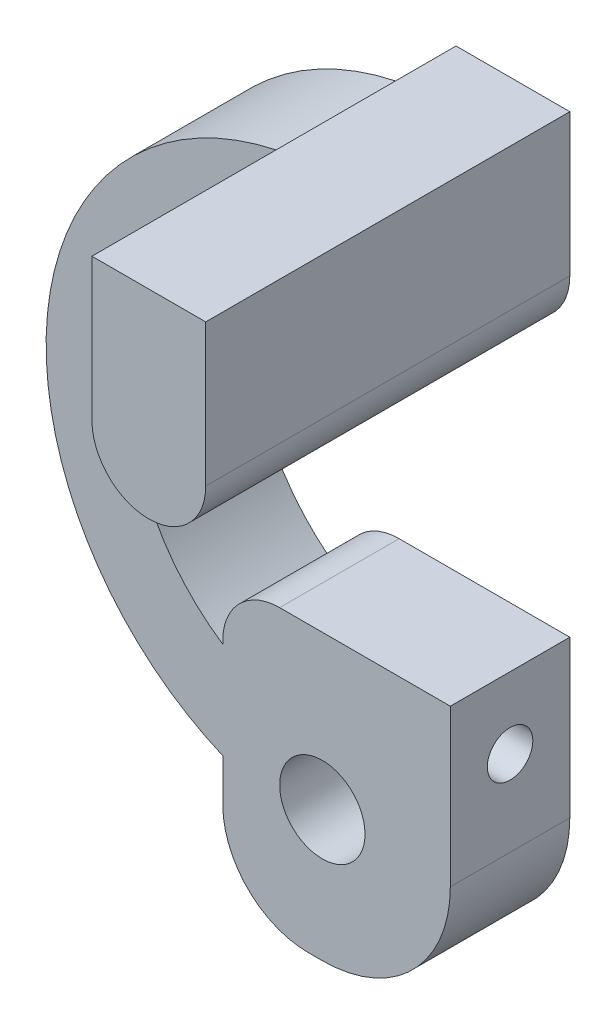
from build123d import *

# Parameters (mm, degrees)
BOSS_EXTRUDE1_DEPTH             = 4.2
SKETCH2_W                       = 4
SKETCH2_H                       = 7
BOSS_EXTRUDE2_DEPTH             = 8.6
FILLET1_R                       = 4.5
HOLE1_D                         = 3
HOLE1_DEPTH                     = 100
FILLET3_R                       = 2
FILLET4_R                       = 2
FILLET5_R                       = 3
TAP_DRILL_FOR_M2X0_4_TAP1_D     = 1.6
TAP_DRILL_FOR_M2X0_4_TAP1_DEPTH = 1.98
TAP_DRILL_FOR_M2X0_4_TAP1_TIP   = 0.480688495


with BuildPart() as part:
    # Sketch1 → Boss-Extrude1 (new body)
    with BuildSketch(Plane.XY):
        with BuildLine():
            Line((4, 26), (4, 24.096998671))
            ThreePointArc((4, 24.096998671), (6.041195573, 23.890909602), (8, 23.280961007))
            Line((8, 23.280961007), (8, 26))
            Line((8, 26), (4, 26))
        make_face()
        with BuildLine():
            ThreePointArc((8, 23.280961007), (6.041195573, 23.890909602), (4, 24.096998671))
            Line((4, 24.096998671), (4, 21.096998671))
            ThreePointArc((4, 21.096998671), (6.089651945, 20.787605561), (8, 19.885973898))
            Line((8, 19.885973898), (8, 23.280961007))
        make_face()
        with BuildLine():
            ThreePointArc((8, 19.885973898), (6.089651945, 20.787605561), (4, 21.096998671))
            Line((4, 21.096998671), (4, 19))
            Line((4, 19), (8, 19))
            Line((8, 19), (8, 19.885973898))
        make_face()
        with BuildLine():
            Line((4, 21.096998671), (4, 24.096998671))
            ThreePointArc((4, 24.096998671), (1.958804427, 23.890909602), (0, 23.280961007))
            Line((0, 23.280961007), (0, 19.885973898))
            ThreePointArc((0, 19.885973898), (1.910348055, 20.787605561), (4, 21.096998671))
        make_face()
        with BuildLine():
            Line((0, 7.885047636), (0, 4.490060527))
            ThreePointArc((0, 4.490060527), (1.958804427, 3.880111932), (4, 3.674022863))
            Line((4, 3.674022863), (4, 6.674022863))
            ThreePointArc((4, 6.674022863), (1.910348055, 6.983415973), (0, 7.885047636))
        make_face()
        with BuildLine():
            Line((0, 19.885973898), (0, 23.280961007))
            ThreePointArc((0, 23.280961007), (-6.211487904, 13.885510767), (0, 4.490060527))
            Line((0, 4.490060527), (0, 7.885047636))
            ThreePointArc((0, 7.885047636), (-3.211487904, 13.885510767), (0, 19.885973898))
        make_face()
        with BuildLine():
            ThreePointArc((4, 3.674022863), (1.958804427, 3.880111932), (0, 4.490060527))
            Line((0, 4.490060527), (0, 0))
            Line((0, 0), (8, 0))
            Line((8, 0), (8, 4.490060527))
            ThreePointArc((8, 4.490060527), (6.041195573, 3.880111932), (4, 3.674022863))
        make_face()
        with BuildLine():
            Line((8, 10), (4, 10))
            Line((4, 10), (4, 6.674022863))
            ThreePointArc((4, 6.674022863), (6.089651945, 6.983415973), (8, 7.885047636))
            Line((8, 7.885047636), (8, 10))
        make_face()
        with BuildLine():
            Line((4, 6.674022863), (4, 10))
            Line((4, 10), (0, 10))
            Line((0, 10), (0, 7.885047636))
            ThreePointArc((0, 7.885047636), (1.910348055, 6.983415973), (4, 6.674022863))
        make_face()
        with BuildLine():
            ThreePointArc((4, 3.674022863), (6.041195573, 3.880111932), (8, 4.490060527))
            Line((8, 4.490060527), (8, 7.885047636))
            ThreePointArc((8, 7.885047636), (6.089651945, 6.983415973), (4, 6.674022863))
            Line((4, 6.674022863), (4, 3.674022863))
        make_face()
    extrude(amount=BOSS_EXTRUDE1_DEPTH)

    # Sketch2 → Boss-Extrude2 (add)
    with BuildSketch(Plane.XY.offset(4.2)):
        with Locations((6, 22.5)):
            Rectangle(SKETCH2_W, SKETCH2_H)
    extrude(amount=BOSS_EXTRUDE2_DEPTH)

    # Fillet1
    fillet1_edges = [part.edges().sort_by_distance(p)[0] for p in [
        (8, 0, 2.1),
    ]]
    fillet(fillet1_edges, radius=FILLET1_R)

    # Hole1
    with Locations(Plane(origin=(3.5, 4.6, 4.2), x_dir=(1, 0, 0), z_dir=(0, 0, 1))):
        with Locations((0, 0)):
            Hole(HOLE1_D / 2, depth=HOLE1_DEPTH)

    # Fillet3
    fillet3_edges = [part.edges().sort_by_distance(p)[0] for p in [
        (0, 10, 2.1),
    ]]
    fillet(fillet3_edges, radius=FILLET3_R)

    # Fillet4
    fillet4_edges = [part.edges().sort_by_distance(p)[0] for p in [
        (8, 19, 6.4),
        (4, 19, 6.4),
    ]]
    fillet(fillet4_edges, radius=FILLET4_R - 0.0001)  # a hair under: the kernel refuses the full size

    # Fillet5
    fillet5_edges = [part.edges().sort_by_distance(p)[0] for p in [
        (0, 0, 2.1),
    ]]
    fillet(fillet5_edges, radius=FILLET5_R)

    # Tap Drill for M2x0.4 Tap1
    with Locations(Plane(origin=(8, 7.5, 2.1), x_dir=(0, 0, 1), z_dir=(1, 0, 0))):
        with Locations((0, 0)):
            Hole(TAP_DRILL_FOR_M2X0_4_TAP1_D / 2, depth=TAP_DRILL_FOR_M2X0_4_TAP1_DEPTH)
            with Locations((0, 0, -(TAP_DRILL_FOR_M2X0_4_TAP1_DEPTH + TAP_DRILL_FOR_M2X0_4_TAP1_TIP / 2))):  # 118° drill point
                Cone(0, TAP_DRILL_FOR_M2X0_4_TAP1_D / 2, TAP_DRILL_FOR_M2X0_4_TAP1_TIP, mode=Mode.SUBTRACT)


solid = part.part
